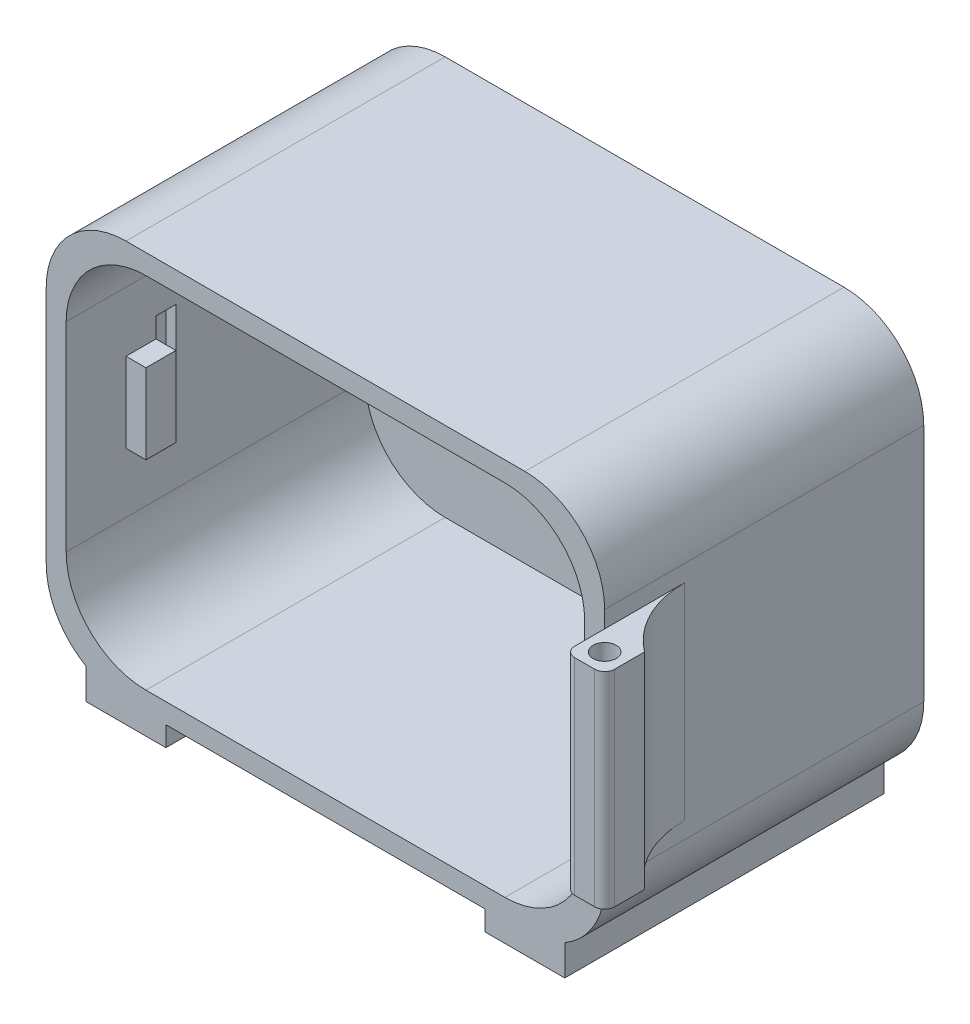
from build123d import *

# Parameters (mm, degrees)
BOSS_EXTRUDE1_DEPTH             = 95.25
BOSS_EXTRUDE2_DEPTH             = 6.35
SKETCH4_W                       = 25.4
SKETCH4_H                       = 101.6
BOSS_EXTRUDE3_DEPTH             = 6.35
BOSS_EXTRUDE3_DIRECTION_2_REACH = 187.35
BOSS_EXTRUDE5_DEPTH             = 32.766
BOSS_EXTRUDE5_DEPTH_BACK        = 32.766
SKETCH5_R                       = 3.675
FILLET1_R                       = 3.175
SKETCH8_W                       = 6.35
SKETCH8_H                       = 38.1
CUT_EXTRUDE1_DEPTH              = 3.175
SKETCH10_W                      = 9.525
SKETCH10_H                      = 25.4
BOSS_EXTRUDE6_DEPTH             = 6.35
SKETCH11_R                      = 44.824096384
CUT_EXTRUDE4_DEPTH              = 1.5875
SKETCH12_W                      = 1.13974359
SKETCH12_H                      = 13.025641026
SKETCH12_W_2                    = 4.884615385
SKETCH12_H_2                    = 1.302564103
CUT_EXTRUDE5_DEPTH              = 1.5875
FILLET2_R                       = 3.175


with BuildPart() as part:
    # Sketch1 → Boss-Extrude1 (new body)
    with BuildSketch(Plane.XY):
        with BuildLine():
            Line((-63.5, 63.5), (63.5, 63.5))
            ThreePointArc((63.5, 63.5), (81.460512242, 56.060512242), (88.9, 38.1))
            Line((88.9, 38.1), (88.9, -38.1))
            ThreePointArc((88.9, -38.1), (81.460512242, -56.060512242), (63.5, -63.5))
            Line((63.5, -63.5), (-63.5, -63.5))
            ThreePointArc((-63.5, -63.5), (-81.460512242, -56.060512242), (-88.9, -38.1))
            Line((-88.9, -38.1), (-88.9, 38.1))
            ThreePointArc((-88.9, 38.1), (-81.460512242, 56.060512242), (-63.5, 63.5))
        make_face()
        with BuildLine():
            Line((-82.55, 31.75), (-82.55, -31.75))
            ThreePointArc((-82.55, -31.75), (-75.110512242, -49.710512242), (-57.15, -57.15))
            Line((-57.15, -57.15), (57.15, -57.15))
            ThreePointArc((57.15, -57.15), (75.110512242, -49.710512242), (82.55, -31.75))
            Line((82.55, -31.75), (82.55, 31.75))
            ThreePointArc((82.55, 31.75), (75.110512242, 49.710512242), (57.15, 57.15))
            Line((57.15, 57.15), (-57.15, 57.15))
            ThreePointArc((-57.15, 57.15), (-75.110512242, 49.710512242), (-82.55, 31.75))
        make_face(mode=Mode.SUBTRACT)
    extrude(amount=-BOSS_EXTRUDE1_DEPTH)

    # Sketch2 → Boss-Extrude2 (add)
    with BuildSketch(Plane(origin=(0, 0, -95.25), x_dir=(-1, 0, 0), z_dir=(0, 0, -1))):
        with BuildLine():
            Line((-63.5, 63.5), (63.5, 63.5))
            ThreePointArc((63.5, 63.5), (81.460512242, 56.060512242), (88.9, 38.1))
            Line((88.9, 38.1), (88.9, -38.1))
            ThreePointArc((88.9, -38.1), (81.460512242, -56.060512242), (63.5, -63.5))
            Line((63.5, -63.5), (-63.5, -63.5))
            ThreePointArc((-63.5, -63.5), (-81.460512242, -56.060512242), (-88.9, -38.1))
            Line((-88.9, -38.1), (-88.9, 38.1))
            ThreePointArc((-88.9, 38.1), (-81.460512242, 56.060512242), (-63.5, 63.5))
        make_face()
    extrude(amount=BOSS_EXTRUDE2_DEPTH)

    # Sketch4 → Boss-Extrude3 (add)
    with BuildSketch(Plane.XZ.offset(63.5)):
        with Locations((-63.5, -50.8)):
            Rectangle(SKETCH4_W, SKETCH4_H)
        with Locations((63.5, -50.8)):
            Rectangle(SKETCH4_W, SKETCH4_H)
    extrude(amount=BOSS_EXTRUDE3_DEPTH)

    # Sketch4 → Boss-Extrude3 direction 2 (add, up to next)
    with BuildSketch(Plane.XZ.offset(63.5), mode=Mode.PRIVATE) as boss_extrude3_direction_2_sk1:
        with Locations((-63.5, -50.8)):
            Rectangle(SKETCH4_W, SKETCH4_H)
    boss_extrude3_direction_2_tool1 = extrude(boss_extrude3_direction_2_sk1.sketch, amount=-BOSS_EXTRUDE3_DIRECTION_2_REACH, mode=Mode.PRIVATE) - part.part
    # Sketch4 → Boss-Extrude3 direction 2 (add, up to next)
    with BuildSketch(Plane.XZ.offset(63.5), mode=Mode.PRIVATE) as boss_extrude3_direction_2_sk2:
        with Locations((63.5, -50.8)):
            Rectangle(SKETCH4_W, SKETCH4_H)
    boss_extrude3_direction_2_tool2 = extrude(boss_extrude3_direction_2_sk2.sketch, amount=-BOSS_EXTRUDE3_DIRECTION_2_REACH, mode=Mode.PRIVATE) - part.part
    add(boss_extrude3_direction_2_tool1.solids().sort_by_distance((-63.5, -63.5, -50.8))[0])
    add(boss_extrude3_direction_2_tool2.solids().sort_by_distance((63.5, -63.5, -50.8))[0])

    # Sketch5 → Boss-Extrude5 (add, two sides: drawn at the far end of the back side and taken through both)
    with BuildSketch(Plane(origin=(0, 0, 0), x_dir=(1, 0, 0), z_dir=(0, 1, 0)).offset(-BOSS_EXTRUDE5_DEPTH_BACK)):
        with BuildLine():
            ThreePointArc((101.6, 0), (92.251936686, 11.200968343), (88.9, 25.4))
            Line((88.9, 25.4), (88.9, 0))
            Line((88.9, 0), (88.9, -12.7))
            Line((88.9, -12.7), (101.6, -12.7))
            Line((101.6, -12.7), (101.6, 0))
        make_face()
        with Locations((95.25, -6.35)):
            Circle(SKETCH5_R, mode=Mode.SUBTRACT)
    extrude(amount=BOSS_EXTRUDE5_DEPTH + BOSS_EXTRUDE5_DEPTH_BACK)

    # Fillet1
    fillet1_edges = [part.edges().sort_by_distance(p)[0] for p in [
        (101.6, 0, 12.7),
    ]]
    fillet(fillet1_edges, radius=FILLET1_R)

    # Sketch8 → Cut-Extrude1 (cut)
    with BuildSketch(Plane(origin=(-82.55, 0, 0), x_dir=(0, 0, -1), z_dir=(1, 0, 0))):
        with Locations((31.75, 0)):
            Rectangle(SKETCH8_W, SKETCH8_H)
    extrude(amount=-CUT_EXTRUDE1_DEPTH, mode=Mode.SUBTRACT)

    # Sketch10 → Boss-Extrude6 (add)
    with BuildSketch(Plane(origin=(-82.55, 0, 0), x_dir=(0, 0, -1), z_dir=(1, 0, 0))):
        with Locations((23.8125, 0)):
            Rectangle(SKETCH10_W, SKETCH10_H)
    extrude(amount=BOSS_EXTRUDE6_DEPTH)

    # Sketch11 → Cut-Extrude4 (cut)
    # profile 1 of 2: a face of its own
    with BuildSketch(Plane(origin=(0, 0, -101.6), x_dir=(-1, 0, 0), z_dir=(0, 0, -1))):
        with Locations((0, 3.175)):
            Circle(SKETCH11_R)
        with BuildLine():
            Line((-8.558023622, 38.277554278), (9.414722671, 38.277554278))
            Line((9.414722671, 38.277554278), (12.376141094, 30.516595652))
            Line((12.376141094, 30.516595652), (6.555422124, 30.516595652))
            ThreePointArc((6.555422124, 30.516595652), (-1.070912861, 28.84594719), (6.555422124, 27.175298727))
            Line((6.555422124, 27.175298727), (13.309498487, 27.175298727))
            Line((13.309498487, 27.175298727), (31.249567059, -24.733260338))
            Line((31.249567059, -24.733260338), (24.338229167, -24.733260338))
            Line((24.338229167, -24.733260338), (24.338229167, -18.851270642))
            ThreePointArc((24.338229167, -18.851270642), (22.794206871, -11.23122082), (21.250184576, -18.851270642))
            Line((21.250184576, -18.851270642), (21.250184576, -24.733260338))
            Line((21.250184576, -24.733260338), (16.103443592, -24.733260338))
            Line((16.103443592, -24.733260338), (16.103443592, -18.851270642))
            ThreePointArc((16.103443592, -18.851270642), (14.239792343, -11.126064356), (12.376141094, -18.851270642))
            Line((12.376141094, -18.851270642), (12.376141094, -24.733260338))
            Line((12.376141094, -24.733260338), (10.515553381, -24.733260338))
            Line((10.515553381, -24.733260338), (8.456856988, -17.527822961))
            Line((8.456856988, -17.527822961), (-7.424515191, -17.527822961))
            Line((-7.424515191, -17.527822961), (-9.630261327, -24.733260338))
            Line((-9.630261327, -24.733260338), (-30.070175519, -24.733260338))
            Line((-30.070175519, -24.733260338), (-27.864429383, -17.527822961))
            Line((-27.864429383, -17.527822961), (-20.953091491, -17.527822961))
            ThreePointArc((-20.953091491, -17.527822961), (-12.798886715, -15.836750923), (-20.953091491, -14.145678885))
            Line((-20.953091491, -14.145678885), (-26.540981702, -14.145678885))
            Line((-26.540981702, -14.145678885), (-8.558023622, 38.277554278))
        make_face(mode=Mode.SUBTRACT)
    # profile 2 of 2: a face of its own
    with BuildSketch(Plane(origin=(0, 0, -101.6), x_dir=(-1, 0, 0), z_dir=(0, 0, -1))):
        Polygon((0.754840192, 15.029545848), (-4.852280703, -6.689071297), (6.018431459, -6.689071297), align=None)
    extrude(amount=-CUT_EXTRUDE4_DEPTH, mode=Mode.SUBTRACT)

    # Sketch12 → Cut-Extrude5 (cut)
    # profile 1 of 11: a face of its own
    with BuildSketch(Plane(origin=(0, 0, -101.6), x_dir=(-1, 0, 0), z_dir=(0, 0, -1))):
        with BuildLine():
            Line((51.288461538, -47.869230769), (52.428205128, -47.869230769))
            Line((52.428205128, -47.869230769), (52.428205128, -55.234314904))
            add(Edge.make_bspline(
                [(52.428205128, -55.234314904), (52.427199859, -55.391205604), (52.425259449, -55.694042448), (52.411285924, -56.131932206), (52.381819467, -56.536394859), (52.348405109, -56.909275054), (52.300338453, -57.248844425), (52.241641349, -57.556116225), (52.175471884, -57.831385323), (52.117341381, -58.000929746), (52.08984375, -58.081129808)],
                knots=[0, 0, 0, 0, 1.307562039, 2.523909702, 3.650326591, 4.686913197, 5.643429486, 6.506965704, 7.293745905, 8, 8, 8, 8], degree=3))
            add(Edge.make_bspline(
                [(52.08984375, -58.081129808), (52.049242798, -58.18537838), (51.969254836, -58.39075856), (51.819446966, -58.681894524), (51.651683945, -58.956019996), (51.460070878, -59.211607319), (51.245474246, -59.44737343), (51.012949975, -59.668440513), (50.757969566, -59.870131635), (50.48067881, -60.048966857), (50.187469798, -60.210028454), (49.878511085, -60.349534569), (49.555544866, -60.471043973), (49.215537231, -60.562058689), (48.863818951, -60.640924675), (48.496253987, -60.692249677), (48.114989839, -60.727182146), (47.855745174, -60.730412419), (47.72421875, -60.732051282)],
                knots=[0, 0, 0, 0, 0.981931301, 1.934503488, 2.87077864, 3.801706999, 4.735015492, 5.667491629, 6.616593066, 7.585388521, 8.561939025, 9.551802639, 10.560317337, 11.588439944, 12.640189604, 13.723962949, 14.845264515, 16, 16, 16, 16], degree=3))
            add(Edge.make_bspline(
                [(47.72421875, -60.732051282), (47.532322713, -60.728943462), (47.157498196, -60.722873055), (46.611017223, -60.652148877), (46.092005525, -60.552165866), (45.607321067, -60.400834743), (45.160026716, -60.21564338), (44.753177225, -60.003027408), (44.39042492, -59.759226202), (44.063404735, -59.481638307), (43.768250965, -59.151570091), (43.490566228, -58.762591428), (43.223282238, -58.308777287), (43.066641753, -57.975700871), (42.984615385, -57.801282051)],
                knots=[0, 0, 0, 0, 1.157897085, 2.2616841, 3.32207898, 4.345638746, 5.321241055, 6.241986252, 7.112515963, 7.955008012, 8.825025602, 9.77857164, 10.836726669, 12, 12, 12, 12], degree=3))
            Line((42.984615385, -57.801282051), (44.124358974, -57.801282051))
            add(Edge.make_bspline(
                [(44.124358974, -57.801282051), (44.216024705, -57.946809086), (44.395219921, -58.231296519), (44.730312981, -58.599644257), (45.097547365, -58.914435037), (45.509316501, -59.168111274), (45.967333711, -59.359372517), (46.471874544, -59.495717165), (47.0270446, -59.577346476), (47.413553549, -59.5871846), (47.614823718, -59.592307692)],
                knots=[0, 0, 0, 0, 0.997731894, 1.950442991, 2.880492273, 3.800895997, 4.748200782, 5.754801363, 6.83083817, 8, 8, 8, 8], degree=3))
            add(Edge.make_bspline(
                [(47.614823718, -59.592307692), (47.813549291, -59.587118295), (48.196672306, -59.577113657), (48.747602548, -59.495680734), (49.25050418, -59.359342846), (49.702479765, -59.168449559), (50.098196411, -58.934586655), (50.439325637, -58.673329242), (50.715622033, -58.378758174), (50.90145194, -58.107407049), (51.016966124, -57.865656635), (51.090525383, -57.657548644), (51.150302358, -57.422225345), (51.200303483, -57.160475674), (51.241563654, -56.871925661), (51.267699828, -56.55591554), (51.286589487, -56.213163505), (51.287823092, -55.975516975), (51.288461538, -55.852524038)],
                knots=[0, 0, 0, 0, 1.570740765, 3.028230971, 4.391408896, 5.680370741, 6.894727393, 8.017376726, 9.065722033, 10.075533815, 10.603371122, 11.180248986, 11.817768598, 12.521299649, 13.286540596, 14.121245857, 15.027658897, 16, 16, 16, 16], degree=3))
            Line((51.288461538, -55.852524038), (51.288461538, -55.371694712))
            add(Edge.make_bspline(
                [(51.288461538, -55.371694712), (51.172778627, -55.509369251), (50.94344763, -55.782296676), (50.547398758, -56.139934615), (50.114811664, -56.447950002), (49.64642281, -56.70056619), (49.153705474, -56.902610217), (48.641996238, -57.043917532), (48.115882209, -57.135212026), (47.759367265, -57.145035716), (47.579206731, -57.15)],
                knots=[0, 0, 0, 0, 1.012485704, 2.007162095, 2.997754123, 3.998611389, 4.999708251, 5.992315798, 6.98544096, 8, 8, 8, 8], degree=3))
            add(Edge.make_bspline(
                [(47.579206731, -57.15), (47.473120839, -57.14813119), (47.262204473, -57.144415684), (46.948860104, -57.111908121), (46.640139657, -57.064741256), (46.336763132, -56.995502891), (46.038292765, -56.906632912), (45.745221788, -56.795537889), (45.455177277, -56.66993446), (45.173431413, -56.52198743), (44.90279031, -56.357387059), (44.645295324, -56.179083085), (44.402295197, -55.988008724), (44.176102792, -55.782279829), (43.967014813, -55.562194153), (43.772219063, -55.330097832), (43.594936689, -55.082749942), (43.43152982, -54.824660696), (43.289806709, -54.554111058), (43.165403416, -54.276967683), (43.057237861, -53.993823162), (42.971003403, -53.703729535), (42.905140792, -53.406869688), (42.856117969, -53.103729945), (42.828312474, -52.793376824), (42.823976607, -52.584293643), (42.821794872, -52.479086538)],
                knots=[0, 0, 0, 0, 1.028754217, 2.045334182, 3.052854819, 4.056607503, 5.061168794, 6.071104265, 7.095078842, 8.125279047, 9.155117945, 10.165957491, 11.161587969, 12.151493252, 13.128948131, 14.104219989, 15.088194871, 16.07871515, 17.064853787, 18.047899887, 19.02414258, 20.002704429, 20.980574569, 21.971845993, 22.979467364, 24, 24, 24, 24], degree=3))
            add(Edge.make_bspline(
                [(42.821794872, -52.479086538), (42.823678704, -52.373846733), (42.827439071, -52.163774731), (42.859918339, -51.852155247), (42.906248626, -51.544708439), (42.97957396, -51.244603296), (43.06782997, -50.948422054), (43.177135505, -50.658352398), (43.30855786, -50.374305979), (43.457364666, -50.096072451), (43.624584088, -49.827385391), (43.807944804, -49.572200133), (44.007668176, -49.332394481), (44.220998841, -49.105549178), (44.450541606, -48.893852903), (44.696177721, -48.697819459), (44.955485887, -48.514162849), (45.229269765, -48.346844569), (45.513304861, -48.198863274), (45.800375, -48.063834708), (46.094282881, -47.956668046), (46.389548953, -47.862241372), (46.691373215, -47.79534795), (46.9960549, -47.743741529), (47.304637097, -47.71230097), (47.511294745, -47.708376362), (47.614823718, -47.706410256)],
                knots=[0, 0, 0, 0, 1.008818848, 2.013730394, 3.001654427, 3.987803273, 4.973046549, 5.963777569, 6.957074694, 7.972068341, 8.987420212, 9.989399531, 10.982630087, 11.977756091, 12.973280677, 13.973972381, 14.989194003, 16.018387222, 17.047741039, 18.059210846, 19.057554164, 20.045176975, 21.029480261, 22.018708529, 23.007435371, 24, 24, 24, 24], degree=3))
            add(Edge.make_bspline(
                [(47.614823718, -47.706410256), (47.785551411, -47.711333042), (48.122686145, -47.721054032), (48.618824354, -47.797330759), (49.097586196, -47.918938751), (49.561673282, -48.093166896), (50.014866073, -48.331019892), (50.455670936, -48.644321446), (50.885363223, -49.035881822), (51.150531351, -49.336156501), (51.288461538, -49.492347756)],
                knots=[0, 0, 0, 0, 0.96728863, 1.910097829, 2.838038873, 3.762875196, 4.71315279, 5.730631239, 6.819562287, 8, 8, 8, 8], degree=3))
            Line((51.288461538, -49.492347756), (51.288461538, -47.869230769))
        make_face()
        with BuildLine():
            add(Edge.make_bspline(
                [(47.706410256, -48.846153846), (47.539747417, -48.851818284), (47.209790334, -48.863032669), (46.726144062, -48.958771486), (46.259230618, -49.108798037), (45.817976636, -49.323401242), (45.404656551, -49.585000334), (45.037899346, -49.901920806), (44.717115793, -50.263857006), (44.44576056, -50.667536474), (44.229746744, -51.103045873), (44.076826336, -51.562099108), (43.97794768, -52.037278654), (43.9670342, -52.361573528), (43.961538462, -52.524879808)],
                knots=[0, 0, 0, 0, 1.026226791, 2.031711442, 3.026614839, 4.04107745, 5.047145931, 6.032893242, 7.017642609, 8.019221815, 9.021877557, 10.003543541, 10.994637589, 12, 12, 12, 12], degree=3))
            add(Edge.make_bspline(
                [(43.961538462, -52.524879808), (43.964171922, -52.648009111), (43.969351169, -52.890168444), (44.019148151, -53.24554309), (44.099633367, -53.584017371), (44.213705516, -53.905611758), (44.355048152, -54.212170871), (44.532820469, -54.501582952), (44.742011138, -54.774105742), (44.980982821, -55.027723588), (45.244331407, -55.258721959), (45.529969644, -55.461697135), (45.837510122, -55.627706894), (46.159389119, -55.771183647), (46.503416719, -55.875973408), (46.864637689, -55.955942692), (47.245607559, -56.001694469), (47.505310727, -56.007365193), (47.637720353, -56.01025641)],
                knots=[0, 0, 0, 0, 1.039728707, 2.044842319, 3.024901384, 3.974314358, 4.923051295, 5.871625912, 6.837440708, 7.820715446, 8.810779094, 9.792721783, 10.773906224, 11.758876063, 12.764959493, 13.806266761, 14.881525401, 16, 16, 16, 16], degree=3))
            add(Edge.make_bspline(
                [(47.637720353, -56.01025641), (47.771845989, -56.007471086), (48.034127251, -56.002024414), (48.417198935, -55.955203148), (48.780174878, -55.87964912), (49.122722262, -55.772377571), (49.446134443, -55.635501504), (49.74677833, -55.462285778), (50.031100299, -55.265020553), (50.290022128, -55.03492553), (50.524152671, -54.781342834), (50.728190025, -54.5054085), (50.902051026, -54.211274617), (51.046024285, -53.898974339), (51.155938083, -53.566080658), (51.229666681, -53.213425767), (51.281216871, -52.8426992), (51.286009941, -52.588667936), (51.288461538, -52.458733974)],
                knots=[0, 0, 0, 0, 1.121943988, 2.193949579, 3.223793937, 4.220241907, 5.192961521, 6.155822191, 7.11847367, 8.083710714, 9.04790392, 10.001595906, 10.949595423, 11.902125208, 12.873731292, 13.87582262, 14.913508608, 16, 16, 16, 16], degree=3))
            add(Edge.make_bspline(
                [(51.288461538, -52.458733974), (51.28360082, -52.289577761), (51.274104683, -51.959105963), (51.184489283, -51.477569977), (51.039998806, -51.024837932), (50.837354876, -50.602341676), (50.583420159, -50.214557882), (50.277564793, -49.868668503), (49.925063482, -49.564228252), (49.526929004, -49.310597664), (49.098585417, -49.105708802), (48.650379935, -48.951996086), (48.182977974, -48.864931), (47.866180431, -48.85244892), (47.706410256, -48.846153846)],
                knots=[0, 0, 0, 0, 1.070913519, 2.092188694, 3.091357305, 4.074328408, 5.051968682, 6.018948707, 6.99050112, 7.9935919, 9.000589572, 9.992915277, 10.987769056, 12, 12, 12, 12], degree=3))
        make_face(mode=Mode.SUBTRACT)
    # profile 2 of 11: a face of its own
    with BuildSketch(Plane(origin=(0, 0, -101.6), x_dir=(-1, 0, 0), z_dir=(0, 0, -1))):
        with BuildLine():
            Line((37.611538462, -47.869230769), (38.751282051, -47.869230769))
            Line((38.751282051, -47.869230769), (38.751282051, -49.235396635))
            add(Edge.make_bspline(
                [(38.751282051, -49.235396635), (38.835424119, -49.108194058), (38.996345169, -48.864920117), (39.263817798, -48.543177225), (39.537787029, -48.276785485), (39.819564423, -48.064501288), (40.1112221, -47.905522257), (40.406359039, -47.789070387), (40.709618601, -47.720209843), (40.913406155, -47.71101628), (41.015504808, -47.706410256)],
                knots=[0, 0, 0, 0, 1.2804753, 2.448899062, 3.506932113, 4.484331642, 5.4025378, 6.288909075, 7.142734305, 8, 8, 8, 8], degree=3))
            add(Edge.make_bspline(
                [(41.015504808, -47.706410256), (41.094703192, -47.710730167), (41.257659016, -47.719618664), (41.504338699, -47.782069371), (41.758496367, -47.881775338), (41.922298744, -47.975538432), (42.007692308, -48.024419071)],
                knots=[0, 0, 0, 0, 0.901110191, 1.854092781, 2.881294221, 4, 4, 4, 4], degree=3))
            Line((42.007692308, -48.024419071), (41.381850962, -49.011518429))
            add(Edge.make_bspline(
                [(41.381850962, -49.011518429), (41.327026799, -48.987060892), (41.222960044, -48.940635805), (41.070724903, -48.88569194), (40.93036691, -48.853339902), (40.840945998, -48.848438728), (40.799258814, -48.846153846)],
                knots=[0, 0, 0, 0, 1.180555205, 2.24091978, 3.179933427, 4, 4, 4, 4], degree=3))
            add(Edge.make_bspline(
                [(40.799258814, -48.846153846), (40.70779801, -48.852249982), (40.52124448, -48.864684331), (40.247343582, -48.962433719), (39.981560865, -49.120368162), (39.770480833, -49.295523339), (39.607041802, -49.464425347), (39.490418698, -49.61192098), (39.383438444, -49.7773063), (39.281220787, -49.957754009), (39.188088806, -50.156345165), (39.101167577, -50.371095682), (39.022576846, -50.602254292), (38.977763103, -50.763299437), (38.954807692, -50.845793269)],
                knots=[0, 0, 0, 0, 1.125678352, 2.296057538, 3.5422874, 4.923748041, 5.663163013, 6.437101912, 7.23742474, 8.08941207, 8.991984279, 9.93940061, 10.944477711, 12, 12, 12, 12], degree=3))
            add(Edge.make_bspline(
                [(38.954807692, -50.845793269), (38.937635865, -50.919370442), (38.899601572, -51.082338288), (38.862620849, -51.355745792), (38.826082884, -51.678774497), (38.800332297, -52.052323563), (38.776463402, -52.475460145), (38.763001103, -52.948828862), (38.751741136, -53.472915593), (38.751439722, -53.839308246), (38.751282051, -54.030969551)],
                knots=[0, 0, 0, 0, 0.566838948, 1.255505196, 2.06880316, 3.007127437, 4.065329342, 5.249902469, 6.561414163, 8, 8, 8, 8], degree=3))
            Line((38.751282051, -54.030969551), (38.751282051, -57.15))
            Line((38.751282051, -57.15), (37.611538462, -57.15))
            Line((37.611538462, -57.15), (37.611538462, -47.869230769))
        make_face()
    # profile 3 of 11: a face of its own
    with BuildSketch(Plane(origin=(0, 0, -101.6), x_dir=(-1, 0, 0), z_dir=(0, 0, -1))):
        with BuildLine():
            add(Edge.make_bspline(
                [(30.859575321, -47.706410256), (31.033715082, -47.710118261), (31.375160597, -47.717388753), (31.875206354, -47.795094486), (32.352527276, -47.913920636), (32.808951459, -48.078191733), (33.238633445, -48.298380525), (33.647831959, -48.56112281), (34.035425106, -48.872391078), (34.267737241, -49.113176069), (34.385657051, -49.235396635)],
                knots=[0, 0, 0, 0, 1.054011418, 2.066658804, 3.057071809, 4.030435133, 4.997543892, 5.974964718, 6.972108034, 8, 8, 8, 8], degree=3))
            add(Edge.make_bspline(
                [(34.385657051, -49.235396635), (34.48719157, -49.352287383), (34.688295636, -49.583806722), (34.946162673, -49.959202803), (35.168309477, -50.347968311), (35.346337935, -50.755265754), (35.486709307, -51.17753956), (35.586370547, -51.616241144), (35.645650283, -52.070401661), (35.653643906, -52.378844159), (35.657692308, -52.53505609)],
                knots=[0, 0, 0, 0, 1.025258237, 2.030674902, 3.01204498, 3.988269485, 4.97094183, 5.956517959, 6.965070386, 8, 8, 8, 8], degree=3))
            add(Edge.make_bspline(
                [(35.657692308, -52.53505609), (35.654131455, -52.692173442), (35.647095044, -53.002644657), (35.580533922, -53.459914927), (35.477006839, -53.90330757), (35.328845598, -54.330966258), (35.138860458, -54.744198232), (34.907028535, -55.141198597), (34.631722953, -55.522750623), (34.319651307, -55.885614436), (33.974748785, -56.22004613), (33.600584476, -56.511522994), (33.204511268, -56.761246811), (32.781262529, -56.962401804), (32.334703362, -57.121005574), (31.863870572, -57.232402777), (31.369495603, -57.299755172), (31.031939685, -57.308404138), (30.859575321, -57.312820513)],
                knots=[0, 0, 0, 0, 0.998656419, 1.973391657, 2.932242238, 3.890759089, 4.846373663, 5.82037756, 6.809684879, 7.83454468, 8.860553229, 9.859544525, 10.845671541, 11.83227036, 12.833544569, 13.85385346, 14.904124723, 16, 16, 16, 16], degree=3))
            add(Edge.make_bspline(
                [(30.859575321, -57.312820513), (30.686366481, -57.308389315), (30.347128219, -57.299710591), (29.851008227, -57.23266445), (29.37933161, -57.121056914), (28.932187838, -56.961880583), (28.507119393, -56.761240381), (28.108751247, -56.512277965), (27.734282983, -56.219959687), (27.389307496, -55.885637858), (27.077255414, -55.522744588), (26.801944784, -55.141200163), (26.570114172, -54.744197824), (26.380128689, -54.330966367), (26.231967539, -53.90330754), (26.128440432, -53.459914935), (26.061879316, -53.002644655), (26.054842904, -52.692173441), (26.051282051, -52.53505609)],
                knots=[0, 0, 0, 0, 1.099876186, 2.154163076, 3.173186993, 4.173200201, 5.163417411, 6.152872554, 7.150605724, 8.17532212, 9.198891216, 10.186952605, 11.159729845, 12.11414092, 13.071450619, 14.029093627, 15.002601286, 16, 16, 16, 16], degree=3))
            add(Edge.make_bspline(
                [(26.051282051, -52.53505609), (26.055358063, -52.379693195), (26.063427866, -52.072101363), (26.122647999, -51.6187946), (26.221920475, -51.180835503), (26.362460114, -50.760191633), (26.542129521, -50.35467905), (26.761154766, -49.964952949), (27.021652204, -49.591254359), (27.221956428, -49.36003424), (27.323317308, -49.243028846)],
                knots=[0, 0, 0, 0, 1.031353054, 2.041901799, 3.029428768, 4.008703097, 4.981709435, 5.96992636, 6.972712378, 8, 8, 8, 8], degree=3))
            add(Edge.make_bspline(
                [(27.323317308, -49.243028846), (27.441059338, -49.119748352), (27.672619758, -48.877295569), (28.062142285, -48.566934696), (28.47033415, -48.298724942), (28.904764596, -48.082911246), (29.360813823, -47.912954339), (29.840580789, -47.794788041), (30.342323374, -47.717668724), (30.685439713, -47.710200479), (30.859575321, -47.706410256)],
                knots=[0, 0, 0, 0, 1.027980169, 2.021703884, 2.998553061, 3.971491411, 4.943284454, 5.930300938, 6.949603206, 8, 8, 8, 8], degree=3))
        make_face()
        with BuildLine():
            add(Edge.make_bspline(
                [(30.854487179, -48.846153846), (30.731342133, -48.849653936), (30.488231009, -48.856563761), (30.130382801, -48.909119644), (29.785885671, -48.992386302), (29.454086037, -49.110692449), (29.136102811, -49.26345131), (28.831631551, -49.451078789), (28.539776698, -49.671089802), (28.266247496, -49.923140068), (28.015214535, -50.19847242), (27.795765877, -50.491836465), (27.609166206, -50.798473778), (27.453717629, -51.11870323), (27.337940118, -51.455769989), (27.25385515, -51.805856851), (27.201348849, -52.169677077), (27.19450399, -52.4170042), (27.191025641, -52.542688301)],
                knots=[0, 0, 0, 0, 1.021534396, 2.016698045, 2.994645724, 3.958388632, 4.93408049, 5.916473867, 6.921342795, 7.962252576, 8.998418191, 10.008913653, 10.997312074, 11.973003931, 12.956656626, 13.948281152, 14.957379055, 16, 16, 16, 16], degree=3))
            add(Edge.make_bspline(
                [(27.191025641, -52.542688301), (27.196856115, -52.705074228), (27.208428517, -53.027379928), (27.302536375, -53.502037431), (27.45996659, -53.957720151), (27.672554719, -54.391756752), (27.938914427, -54.793339018), (28.252738926, -55.151375547), (28.610660125, -55.460478348), (29.008411425, -55.716948845), (29.437868522, -55.92072853), (29.89237003, -56.065141956), (30.36640912, -56.15901924), (30.69037063, -56.168350018), (30.854487179, -56.173076923)],
                knots=[0, 0, 0, 0, 1.016792936, 2.018143844, 3.017858371, 4.030088057, 5.03801393, 6.028138512, 7.003788237, 7.991172063, 8.984598303, 9.972568034, 10.972917682, 12, 12, 12, 12], degree=3))
            add(Edge.make_bspline(
                [(30.854487179, -56.173076923), (31.01859429, -56.168322478), (31.342537166, -56.158937334), (31.815917608, -56.06561476), (32.269176877, -55.920095762), (32.698187912, -55.717178029), (33.095758159, -55.45950441), (33.456253542, -55.153120985), (33.767398502, -54.792390724), (34.033494726, -54.391224834), (34.249564335, -53.958393042), (34.406257667, -53.501953328), (34.500591765, -53.027401347), (34.512133629, -52.705081404), (34.517948718, -52.542688301)],
                knots=[0, 0, 0, 0, 1.02726834, 2.027799167, 3.010890988, 4.004497153, 4.992059811, 5.971914811, 6.958719428, 7.966827853, 8.981595046, 9.981490638, 10.983022906, 12, 12, 12, 12], degree=3))
            add(Edge.make_bspline(
                [(34.517948718, -52.542688301), (34.514471567, -52.417003449), (34.507629064, -52.169674847), (34.455105622, -51.805865373), (34.371084092, -51.455738722), (34.255072795, -51.118818596), (34.100299659, -50.797644652), (33.910101582, -50.492736785), (33.691549004, -50.197456175), (33.437486879, -49.924030107), (33.164243194, -49.670991546), (32.872270055, -49.450993476), (32.568250276, -49.264275915), (32.251190847, -49.109385842), (31.919348673, -48.993462636), (31.575334233, -48.908638858), (31.219012837, -48.856785859), (30.97677288, -48.849720517), (30.854487179, -48.846153846)],
                knots=[0, 0, 0, 0, 1.042956736, 2.052379634, 3.044323526, 4.02829302, 5.004299113, 5.996692471, 7.007513377, 8.048758398, 9.090003419, 10.095195979, 11.07790575, 12.047570684, 13.018257071, 13.989683339, 14.985167495, 16, 16, 16, 16], degree=3))
        make_face(mode=Mode.SUBTRACT)
    # profile 4 of 11: a face of its own
    with BuildSketch(Plane(origin=(0, 0, -101.6), x_dir=(-1, 0, 0), z_dir=(0, 0, -1))):
        with BuildLine():
            add(Edge.make_bspline(
                [(22.876282051, -55.196153846), (22.947003678, -55.200356337), (23.08564516, -55.208594828), (23.286084283, -55.265115901), (23.467493477, -55.365477327), (23.629081908, -55.499236551), (23.76227398, -55.661417957), (23.866212057, -55.841380255), (23.922240775, -56.043497462), (23.930419255, -56.182942283), (23.934615385, -56.254487179)],
                knots=[0, 0, 0, 0, 1.020151414, 1.999887582, 2.974338812, 3.990962822, 5.007586832, 5.987933904, 6.967670073, 8, 8, 8, 8], degree=3))
            add(Edge.make_bspline(
                [(23.934615385, -56.254487179), (23.930277062, -56.324312976), (23.921721953, -56.462008421), (23.866340489, -56.662601157), (23.76148185, -56.842675925), (23.63000059, -57.007057969), (23.467453531, -57.141100557), (23.285655403, -57.240608122), (23.086115694, -57.301176163), (22.947082178, -57.308891584), (22.876282051, -57.312820513)],
                knots=[0, 0, 0, 0, 1.009421747, 1.99056486, 2.972319754, 3.999869655, 5.017953583, 5.993804169, 6.978383603, 8, 8, 8, 8], degree=3))
            add(Edge.make_bspline(
                [(22.876282051, -57.312820513), (22.805430908, -57.309033746), (22.667110917, -57.301640985), (22.468316023, -57.239364517), (22.285410737, -57.142033675), (22.122895326, -57.006808032), (21.990312872, -56.843521797), (21.890072197, -56.661360993), (21.829873657, -56.462582635), (21.821956576, -56.324426073), (21.817948718, -56.254487179)],
                knots=[0, 0, 0, 0, 1.022052826, 1.995314843, 2.982371812, 4.00089066, 5.028879526, 6.005146991, 6.990147033, 8, 8, 8, 8], degree=3))
            add(Edge.make_bspline(
                [(21.817948718, -56.254487179), (21.821802621, -56.182825145), (21.829326894, -56.042913817), (21.890198575, -55.842619912), (21.989535115, -55.660580147), (22.123811834, -55.499483985), (22.285371422, -55.364547201), (22.467874795, -55.266340666), (22.667589699, -55.208136885), (22.805511475, -55.200217467), (22.876282051, -55.196153846)],
                knots=[0, 0, 0, 0, 1.032775665, 2.016367738, 2.991239715, 4.008302682, 5.025365648, 6.011011707, 6.979408107, 8, 8, 8, 8], degree=3))
        make_face()
    # profile 5 of 11: a face of its own
    with BuildSketch(Plane(origin=(0, 0, -101.6), x_dir=(-1, 0, 0), z_dir=(0, 0, -1))):
        with BuildLine():
            Line((9.606410256, -57.15), (9.606410256, -44.124358974))
            Line((9.606410256, -44.124358974), (10.746153846, -44.124358974))
            Line((10.746153846, -44.124358974), (10.746153846, -49.553405449))
            add(Edge.make_bspline(
                [(10.746153846, -49.553405449), (10.874581395, -49.405512382), (11.125148837, -49.116966911), (11.54525196, -48.740148296), (11.985780741, -48.420643593), (12.450086412, -48.157259677), (12.938829341, -47.956695446), (13.44948585, -47.810019917), (13.98336134, -47.721530297), (14.347376629, -47.711493403), (14.531730769, -47.706410256)],
                knots=[0, 0, 0, 0, 1.077089805, 2.101446609, 3.097517232, 4.067117542, 5.031729543, 5.997785507, 6.985986182, 8, 8, 8, 8], degree=3))
            add(Edge.make_bspline(
                [(14.531730769, -47.706410256), (14.695619326, -47.710910513), (15.019654935, -47.719808287), (15.496021583, -47.787424885), (15.954358324, -47.897072337), (16.394415675, -48.049081102), (16.81414027, -48.250767906), (17.217125991, -48.492217794), (17.601308192, -48.779739731), (17.96073592, -49.108482173), (18.292002307, -49.465376204), (18.581970558, -49.847030491), (18.826898027, -50.247897247), (19.02948586, -50.666634617), (19.186135109, -51.104952805), (19.29405705, -51.56242204), (19.362613335, -52.038592279), (19.371250228, -52.362670166), (19.375641026, -52.527423878)],
                knots=[0, 0, 0, 0, 1.034377878, 2.045141349, 3.03070803, 4.00595497, 4.978199603, 5.965204761, 6.967410914, 8.002051993, 9.036360596, 10.037508045, 11.022711142, 11.997267194, 12.969246472, 13.954813154, 14.960274251, 16, 16, 16, 16], degree=3))
            add(Edge.make_bspline(
                [(19.375641026, -52.527423878), (19.371154513, -52.689621085), (19.362307816, -53.009448434), (19.29473907, -53.480097938), (19.183174052, -53.933084075), (19.023657758, -54.367236323), (18.823124981, -54.784594294), (18.572349781, -55.180400332), (18.282749868, -55.561541758), (17.947719701, -55.915776078), (17.585176237, -56.243194415), (17.19723027, -56.527695697), (16.793653583, -56.773412104), (16.368156005, -56.968104728), (15.927037683, -57.125588072), (15.465572708, -57.234872264), (14.986371852, -57.298637349), (14.660820457, -57.30805555), (14.496113782, -57.312820513)],
                knots=[0, 0, 0, 0, 1.024244038, 2.01964794, 2.996620209, 3.965911562, 4.936179293, 5.91563013, 6.920572822, 7.955171681, 8.990768464, 10.002129126, 10.989675881, 11.969873457, 12.952483066, 13.943799762, 14.959703725, 16, 16, 16, 16], degree=3))
            add(Edge.make_bspline(
                [(14.496113782, -57.312820513), (14.30755466, -57.307593163), (13.9378231, -57.297343241), (13.396974858, -57.212365802), (12.885050378, -57.067725103), (12.396218131, -56.873372446), (11.937466108, -56.610197044), (11.505881709, -56.28378255), (11.104186614, -55.888750369), (10.867542741, -55.58735582), (10.746153846, -55.432752404)],
                knots=[0, 0, 0, 0, 1.035807596, 2.031038093, 2.998900396, 3.954262848, 4.914341711, 5.895762244, 6.92060972, 8, 8, 8, 8], degree=3))
            Line((10.746153846, -55.432752404), (10.746153846, -57.15))
            Line((10.746153846, -57.15), (9.606410256, -57.15))
        make_face()
        with BuildLine():
            add(Edge.make_bspline(
                [(14.4859375, -56.173076923), (14.652541008, -56.167149184), (14.981389832, -56.15544877), (15.464148729, -56.06410448), (15.926117432, -55.912124982), (16.364968045, -55.704266954), (16.773832977, -55.442929856), (17.139058249, -55.126713752), (17.463741766, -54.765665399), (17.734621068, -54.358417426), (17.960776298, -53.924981052), (18.116127329, -53.469035444), (18.220338889, -53.002782924), (18.230688657, -52.686567277), (18.235897436, -52.527423878)],
                knots=[0, 0, 0, 0, 1.031910345, 2.036826888, 3.032245421, 4.038315463, 5.03827337, 6.029480047, 7.023177075, 8.037597977, 9.052889626, 10.043399556, 11.015292101, 12, 12, 12, 12], degree=3))
            add(Edge.make_bspline(
                [(18.235897436, -52.527423878), (18.229047622, -52.368436055), (18.215375342, -52.051095128), (18.119672559, -51.58065205), (17.952548578, -51.124948383), (17.730777466, -50.685245396), (17.455485062, -50.275188521), (17.132520565, -49.906924345), (16.762835155, -49.589206688), (16.353447319, -49.324357001), (15.917364913, -49.108240909), (15.458384613, -48.960031816), (14.986096568, -48.863010394), (14.665347208, -48.851801271), (14.503745994, -48.846153846)],
                knots=[0, 0, 0, 0, 0.984795267, 1.965658976, 2.959410029, 3.983795688, 5.009594896, 6.01088574, 7.009236619, 8.019050059, 9.024672985, 10.014834719, 10.999826153, 12, 12, 12, 12], degree=3))
            add(Edge.make_bspline(
                [(14.503745994, -48.846153846), (14.338763895, -48.85179808), (14.011307906, -48.863000738), (13.5280975, -48.960202271), (13.056153584, -49.109146461), (12.605167397, -49.322983071), (12.184782682, -49.584644657), (11.808816917, -49.892130523), (11.48467098, -50.243303333), (11.217812154, -50.637024385), (11.00588617, -51.062238657), (10.854270855, -51.515854366), (10.763557852, -51.9954837), (10.752025771, -52.32435276), (10.746153846, -52.491806891)],
                knots=[0, 0, 0, 0, 1.016820015, 2.018181405, 3.029022337, 4.06341356, 5.088169224, 6.076823655, 7.05054209, 8.02560866, 9.001194327, 9.972267242, 10.967515442, 12, 12, 12, 12], degree=3))
            add(Edge.make_bspline(
                [(10.746153846, -52.491806891), (10.749636079, -52.620032689), (10.756490215, -52.872421638), (10.808851838, -53.242999258), (10.892148096, -53.597630765), (11.009508775, -53.936702605), (11.16372754, -54.258289972), (11.349547648, -54.564890034), (11.57071505, -54.853736216), (11.820747532, -55.124120378), (12.096382456, -55.370171681), (12.392194915, -55.58345267), (12.702139979, -55.767109874), (13.029763587, -55.913504017), (13.371253127, -56.032980249), (13.730112822, -56.111842697), (14.102663419, -56.166180696), (14.356834314, -56.170753977), (14.4859375, -56.173076923)],
                knots=[0, 0, 0, 0, 1.050331198, 2.067384183, 3.060053655, 4.031335885, 5.001026174, 5.976994447, 6.963687968, 7.976578778, 8.990422448, 9.985569286, 10.960374351, 11.936812464, 12.921228065, 13.919088064, 14.943024695, 16, 16, 16, 16], degree=3))
        make_face(mode=Mode.SUBTRACT)
    # profile 6 of 11: a face of its own
    with BuildSketch(Plane(origin=(0, 0, -101.6), x_dir=(-1, 0, 0), z_dir=(0, 0, -1))):
        with BuildLine():
            Line((7.001282051, -47.869230769), (7.001282051, -57.15))
            Line((7.001282051, -57.15), (5.861538462, -57.15))
            Line((5.861538462, -57.15), (5.861538462, -55.544691506))
            add(Edge.make_bspline(
                [(5.861538462, -55.544691506), (5.73301885, -55.689978033), (5.482211212, -55.973506517), (5.063324869, -56.343918971), (4.619303195, -56.650091738), (4.152301258, -56.897378575), (3.662740775, -57.083132608), (3.151706973, -57.215162385), (2.618991391, -57.300048587), (2.255218561, -57.308525009), (2.070873397, -57.312820513)],
                knots=[0, 0, 0, 0, 1.074387032, 2.096679803, 3.090159297, 4.057316773, 5.018401886, 5.985159533, 6.978961417, 8, 8, 8, 8], degree=3))
            add(Edge.make_bspline(
                [(2.070873397, -57.312820513), (1.906978251, -57.308370533), (1.583769764, -57.299594977), (1.108321399, -57.231514618), (0.650786665, -57.122183505), (0.210733216, -56.970143135), (-0.208991426, -56.768464154), (-0.61198092, -56.527014482), (-0.996147545, -56.23948347), (-1.355635701, -55.910778339), (-1.686677531, -55.553745099), (-1.977185577, -55.172942687), (-2.219403896, -54.770017755), (-2.421951046, -54.35007174), (-2.577966353, -53.909871889), (-2.686727825, -53.450940451), (-2.754728875, -52.973820053), (-2.763500804, -52.648919497), (-2.767948718, -52.484174679)],
                knots=[0, 0, 0, 0, 1.033919861, 2.038935746, 3.024066025, 3.998881131, 4.97069526, 5.957263378, 6.95902576, 7.993208707, 9.027059324, 10.027763471, 11.009749337, 11.988697705, 12.965288445, 13.950418724, 14.960734635, 16, 16, 16, 16], degree=3))
            add(Edge.make_bspline(
                [(-2.767948718, -52.484174679), (-2.763402222, -52.322834955), (-2.754414044, -52.003875024), (-2.687455218, -51.534778034), (-2.574856986, -51.082954631), (-2.416840511, -50.649859437), (-2.214213988, -50.234968397), (-1.967732073, -49.837988078), (-1.677376963, -49.457824836), (-1.342632515, -49.103417813), (-0.980012063, -48.77604587), (-0.592086096, -48.491533048), (-0.188504476, -48.245817625), (0.236992734, -48.051132154), (0.678107657, -47.893619117), (1.138767303, -47.784642347), (1.617055032, -47.720426353), (1.941777674, -47.71112718), (2.106490385, -47.706410256)],
                knots=[0, 0, 0, 0, 1.020392517, 2.01726096, 2.990465484, 3.961182959, 4.928053699, 5.906110375, 6.912531644, 7.948652711, 8.985773172, 9.998621852, 10.987621588, 11.969261332, 12.953316658, 13.946091881, 14.958173133, 16, 16, 16, 16], degree=3))
            add(Edge.make_bspline(
                [(2.106490385, -47.706410256), (2.295901302, -47.711627241), (2.667327171, -47.7218575), (3.210625947, -47.806993682), (3.724593053, -47.950824692), (4.213195987, -48.146468185), (4.674680191, -48.406450716), (5.104676734, -48.73440086), (5.507685774, -49.12825031), (5.741294261, -49.430765923), (5.861538462, -49.586478365)],
                knots=[0, 0, 0, 0, 1.038897134, 2.037228247, 3.008116434, 3.962042015, 4.918381754, 5.904844433, 6.921570401, 8, 8, 8, 8], degree=3))
            Line((5.861538462, -49.586478365), (5.861538462, -47.869230769))
            Line((5.861538462, -47.869230769), (7.001282051, -47.869230769))
        make_face()
        with BuildLine():
            add(Edge.make_bspline(
                [(2.121754808, -48.846153846), (1.955151353, -48.852081617), (1.626302633, -48.863782095), (1.143542969, -48.95512592), (0.681577152, -49.107107163), (0.242715682, -49.314958633), (-0.166108989, -49.576320048), (-0.531483166, -49.892446211), (-0.856395254, -50.254711948), (-1.12965667, -50.661482462), (-1.352416473, -51.09755725), (-1.509051132, -51.553394497), (-1.61235383, -52.020772558), (-1.622907604, -52.337774304), (-1.628205128, -52.496895032)],
                knots=[0, 0, 0, 0, 1.031046209, 2.035121221, 3.029706178, 4.034933723, 5.034054252, 6.02443088, 7.017295772, 8.038157696, 9.050218397, 10.03989886, 11.016116709, 12, 12, 12, 12], degree=3))
            add(Edge.make_bspline(
                [(-1.628205128, -52.496895032), (-1.62143823, -52.65506485), (-1.607930956, -52.970784512), (-1.510864151, -53.438799748), (-1.348014325, -53.894744415), (-1.125793126, -54.334748591), (-0.84753023, -54.743268041), (-0.524991405, -55.112439343), (-0.155057527, -55.429901563), (0.254707998, -55.695649331), (0.692342634, -55.910324763), (1.152568614, -56.059697227), (1.626734501, -56.156136602), (1.949141541, -56.167401418), (2.111578526, -56.173076923)],
                knots=[0, 0, 0, 0, 0.979072187, 1.954306742, 2.945804271, 3.96968567, 4.997920485, 5.998718438, 6.996577872, 8.005894225, 9.015743152, 10.005417472, 10.995077863, 12, 12, 12, 12], degree=3))
            add(Edge.make_bspline(
                [(2.111578526, -56.173076923), (2.276484407, -56.167053625), (2.60446585, -56.155073884), (3.088657732, -56.063339007), (3.558539455, -55.911777939), (4.007710255, -55.701686822), (4.426143073, -55.44131013), (4.801692515, -55.1364844), (5.119250458, -54.781961417), (5.388463641, -54.392338288), (5.599557296, -53.965211901), (5.753321853, -53.510427837), (5.84423174, -53.027970265), (5.855689788, -52.698264016), (5.861538462, -52.529967949)],
                knots=[0, 0, 0, 0, 1.01762866, 2.023962475, 3.030623092, 4.058876274, 5.077231937, 6.066672613, 7.034107872, 8.005628644, 8.981990164, 9.965428785, 10.961468474, 12, 12, 12, 12], degree=3))
            add(Edge.make_bspline(
                [(5.861538462, -52.529967949), (5.85805628, -52.401742107), (5.851202244, -52.149353071), (5.798839892, -51.778776079), (5.715546302, -51.424142273), (5.598175914, -51.085078801), (5.443993253, -50.763460317), (5.258037074, -50.45697753), (5.037037299, -50.167224449), (4.784551516, -49.89819102), (4.508180638, -49.652803571), (4.215737591, -49.433767612), (3.903757566, -49.253831208), (3.577487175, -49.104910023), (3.236360333, -48.986403964), (2.877601227, -48.907345761), (2.505023188, -48.853061168), (2.250856073, -48.848480529), (2.121754808, -48.846153846)],
                knots=[0, 0, 0, 0, 1.050140795, 2.067009409, 3.05949893, 4.030605086, 5.00011959, 5.97591094, 6.962425594, 7.979863591, 8.993523472, 9.986985069, 10.967611495, 11.937549037, 12.921786183, 13.919465291, 14.943216303, 16, 16, 16, 16], degree=3))
        make_face(mode=Mode.SUBTRACT)
    # profile 7 of 11: a face of its own
    with BuildSketch(Plane(origin=(0, 0, -101.6), x_dir=(-1, 0, 0), z_dir=(0, 0, -1))):
        with Locations((-5.617307692, -50.637179487)):
            Rectangle(SKETCH12_W, SKETCH12_H)
    # profile 8 of 11: a face of its own
    with BuildSketch(Plane(origin=(0, 0, -101.6), x_dir=(-1, 0, 0), z_dir=(0, 0, -1))):
        with Locations((-10.257692308, -52.265384616)):
            Rectangle(SKETCH12_W_2, SKETCH12_H_2)
    # profile 9 of 11: a face of its own
    with BuildSketch(Plane(origin=(0, 0, -101.6), x_dir=(-1, 0, 0), z_dir=(0, 0, -1))):
        with BuildLine():
            Line((-23.934615385, -47.869230769), (-22.794871795, -47.869230769))
            Line((-22.794871795, -47.869230769), (-22.794871795, -49.586478365))
            add(Edge.make_bspline(
                [(-22.794871795, -49.586478365), (-22.673831781, -49.430675731), (-22.438614738, -49.127904491), (-22.03321294, -48.736054596), (-21.605307091, -48.405581351), (-21.143885565, -48.146564732), (-20.656119604, -47.951272071), (-20.14401091, -47.806929496), (-19.603213106, -47.721870431), (-19.233474549, -47.711631832), (-19.044911859, -47.706410256)],
                knots=[0, 0, 0, 0, 1.0828784, 2.104357462, 3.088488658, 4.04616522, 5.001424249, 5.969181776, 6.964304535, 8, 8, 8, 8], degree=3))
            add(Edge.make_bspline(
                [(-19.044911859, -47.706410256), (-18.880205185, -47.71117522), (-18.55465379, -47.72059342), (-18.075452931, -47.784358504), (-17.613987968, -47.893642702), (-17.1728696, -48.051126024), (-16.747372192, -48.245818729), (-16.343794859, -48.491534829), (-15.955851385, -48.776037293), (-15.593298356, -49.103451098), (-15.25830368, -49.457702236), (-14.968576108, -49.838783168), (-14.718669484, -50.234161696), (-14.516665837, -50.649967287), (-14.358429833, -51.082925636), (-14.24589086, -51.534785978), (-14.178915983, -52.003872962), (-14.169930001, -52.322834263), (-14.165384615, -52.484174679)],
                knots=[0, 0, 0, 0, 1.041296284, 2.058176809, 3.050446431, 4.034000596, 5.01514041, 6.003636468, 7.015969324, 8.052561599, 9.08815499, 10.094063707, 11.074456064, 12.040834395, 13.011057502, 13.983766392, 14.980127149, 16, 16, 16, 16], degree=3))
            add(Edge.make_bspline(
                [(-14.165384615, -52.484174679), (-14.169831377, -52.648920199), (-14.178601033, -52.973822138), (-14.246618626, -53.450932462), (-14.355319284, -53.909900933), (-14.511558977, -54.349964147), (-14.713458092, -54.77081911), (-14.959128925, -55.172162319), (-15.249002677, -55.553865184), (-15.580295341, -55.910745707), (-15.939715994, -56.239491786), (-16.323900028, -56.527012781), (-16.726885272, -56.768462914), (-17.146609993, -56.970149653), (-17.586667309, -57.122158436), (-18.04500406, -57.231805884), (-18.521370706, -57.299422482), (-18.845406314, -57.308320256), (-19.009294872, -57.312820513)],
                knots=[0, 0, 0, 0, 1.038740735, 2.04854663, 3.033179607, 4.009277356, 4.987731542, 5.972001279, 6.972200261, 8.005528982, 9.039189865, 10.040446548, 11.026516639, 11.997840187, 12.972163198, 13.956796175, 14.96660207, 16, 16, 16, 16], degree=3))
            add(Edge.make_bspline(
                [(-19.009294872, -57.312820513), (-19.193726347, -57.308122211), (-19.558032582, -57.298841686), (-20.090698415, -57.204791255), (-20.603331563, -57.064231517), (-21.090252556, -56.858495169), (-21.555318618, -56.596310869), (-21.995899056, -56.276596693), (-22.414334131, -55.900021283), (-22.666188765, -55.614337264), (-22.794871795, -55.468369391)],
                knots=[0, 0, 0, 0, 1.014726462, 2.004382257, 2.969841629, 3.936926163, 4.907207904, 5.903978561, 6.929055279, 8, 8, 8, 8], degree=3))
            Line((-22.794871795, -55.468369391), (-22.794871795, -60.569230769))
            Line((-22.794871795, -60.569230769), (-23.934615385, -60.569230769))
            Line((-23.934615385, -60.569230769), (-23.934615385, -47.869230769))
        make_face()
        with BuildLine():
            add(Edge.make_bspline(
                [(-19.055088141, -48.846153846), (-19.184191125, -48.848477069), (-19.438361623, -48.853050895), (-19.810915104, -48.907384938), (-20.169764227, -48.986261885), (-20.511292451, -49.105685066), (-20.838773259, -49.252275045), (-21.149684371, -49.435452628), (-21.443807545, -49.651904192), (-21.72040277, -49.897483526), (-21.970278149, -50.168083109), (-22.191486488, -50.456873159), (-22.377295852, -50.763487951), (-22.531517468, -51.085071409), (-22.648877379, -51.424144301), (-22.732173848, -51.778775519), (-22.784535414, -52.149353218), (-22.791389558, -52.401742156), (-22.794871795, -52.529967949)],
                knots=[0, 0, 0, 0, 1.05670511, 2.080379991, 3.077984906, 4.06214886, 5.038337365, 6.01289324, 7.01187578, 8.025460281, 9.038092164, 10.024533457, 11.000252242, 11.969694649, 12.940728589, 13.933144304, 14.949937299, 16, 16, 16, 16], degree=3))
            add(Edge.make_bspline(
                [(-22.794871795, -52.529967949), (-22.78909926, -52.698290528), (-22.777790375, -53.028048718), (-22.685851925, -53.509865389), (-22.536226825, -53.965801396), (-22.323851206, -54.392017159), (-22.055527151, -54.783840589), (-21.732228126, -55.134689361), (-21.356879441, -55.442358077), (-20.935721346, -55.701515198), (-20.484246757, -55.911929039), (-20.013309305, -56.062566317), (-19.529385309, -56.155356974), (-19.20220312, -56.167138289), (-19.037279647, -56.173076923)],
                knots=[0, 0, 0, 0, 1.03728447, 2.032128127, 3.01272805, 3.987917167, 4.958271349, 5.931593992, 6.91984656, 7.941419022, 8.973179163, 9.983609215, 10.983593296, 12, 12, 12, 12], degree=3))
            add(Edge.make_bspline(
                [(-19.037279647, -56.173076923), (-18.875678432, -56.167429498), (-18.554929072, -56.156220376), (-18.082641031, -56.059198952), (-17.623660715, -55.910989863), (-17.187578375, -55.694873758), (-16.77819029, -55.430024119), (-16.408505796, -55.112306285), (-16.085537853, -54.744042776), (-15.810258621, -54.333983352), (-15.58843866, -53.894289817), (-15.421777504, -53.439334492), (-15.325589253, -52.9707211), (-15.311957477, -52.655043684), (-15.305128205, -52.496895032)],
                knots=[0, 0, 0, 0, 1.00104056, 1.986885549, 2.97790532, 3.984399681, 4.995088187, 5.994304198, 6.996462723, 8.023150851, 9.048424203, 10.043036403, 11.019596776, 12, 12, 12, 12], degree=3))
            add(Edge.make_bspline(
                [(-15.305128205, -52.496895032), (-15.310406811, -52.337764072), (-15.320922896, -52.020741941), (-15.424507862, -51.55351655), (-15.580173495, -51.096723037), (-15.807173484, -50.663034185), (-16.07641809, -50.253825371), (-16.402071479, -49.89258701), (-16.767164535, -49.576281997), (-17.176065215, -49.314968939), (-17.614906188, -49.107104429), (-18.076877454, -48.955126653), (-18.559635668, -48.863781905), (-18.888484586, -48.852081554), (-19.055088141, -48.846153846)],
                knots=[0, 0, 0, 0, 0.983928682, 1.960191568, 2.949917689, 3.96440592, 4.982380491, 5.975291189, 6.965713506, 7.964880129, 8.970154049, 9.96478489, 10.968906225, 12, 12, 12, 12], degree=3))
        make_face(mode=Mode.SUBTRACT)
    # profile 10 of 11: a face of its own
    with BuildSketch(Plane(origin=(0, 0, -101.6), x_dir=(-1, 0, 0), z_dir=(0, 0, -1))):
        with BuildLine():
            Line((-40.379487179, -47.869230769), (-39.23974359, -47.869230769))
            Line((-39.23974359, -47.869230769), (-39.23974359, -49.482171474))
            add(Edge.make_bspline(
                [(-39.23974359, -49.482171474), (-39.137113257, -49.341065034), (-38.940463701, -49.070691566), (-38.618008333, -48.714401106), (-38.295877868, -48.412038945), (-38.063891026, -48.253314811), (-37.95244391, -48.177063301)],
                knots=[0, 0, 0, 0, 1.134379233, 2.173579362, 3.122582517, 4, 4, 4, 4], degree=3))
            add(Edge.make_bspline(
                [(-37.95244391, -48.177063301), (-37.800534993, -48.104472405), (-37.499371186, -47.960558859), (-37.022507141, -47.814568516), (-36.534556197, -47.72485172), (-36.205052107, -47.712582165), (-36.039302885, -47.706410256)],
                knots=[0, 0, 0, 0, 1.014936303, 2.012140481, 3.000054389, 4, 4, 4, 4], degree=3))
            add(Edge.make_bspline(
                [(-36.039302885, -47.706410256), (-35.92720544, -47.710203169), (-35.705370625, -47.717709138), (-35.376679783, -47.766549837), (-35.057878535, -47.850972808), (-34.750850485, -47.968565098), (-34.461578306, -48.110974504), (-34.196368932, -48.278069159), (-33.958246805, -48.46565569), (-33.747332276, -48.682204961), (-33.557670384, -48.933797761), (-33.383212854, -49.227219464), (-33.222012798, -49.569058692), (-33.13267262, -49.817131569), (-33.085637019, -49.947736378)],
                knots=[0, 0, 0, 0, 1.009824226, 1.998387844, 2.986035974, 3.974953746, 4.955485308, 5.885931332, 6.793869504, 7.679848016, 8.601185859, 9.625726857, 10.749998409, 12, 12, 12, 12], degree=3))
            add(Edge.make_bspline(
                [(-33.085637019, -49.947736378), (-33.035884764, -49.858022057), (-32.937979314, -49.681476871), (-32.773584573, -49.431619748), (-32.601344283, -49.197915104), (-32.419790551, -48.980177507), (-32.229564193, -48.779482199), (-32.029769969, -48.595165642), (-31.821545191, -48.426436295), (-31.532013349, -48.22932083), (-31.155321888, -48.019947972), (-30.680385015, -47.83841619), (-30.186354392, -47.72623481), (-29.851010173, -47.713062106), (-29.681670673, -47.706410256)],
                knots=[0, 0, 0, 0, 0.86119277, 1.694706429, 2.50939023, 3.298075842, 4.073795165, 4.829715201, 5.57930267, 6.321991688, 7.768977793, 9.186738141, 10.579381044, 12, 12, 12, 12], degree=3))
            add(Edge.make_bspline(
                [(-29.681670673, -47.706410256), (-29.526072222, -47.712278458), (-29.221550946, -47.723763098), (-28.778222011, -47.813945701), (-28.364776032, -47.968804592), (-27.982044927, -48.180109502), (-27.636750747, -48.445645395), (-27.33660871, -48.761580892), (-27.083441963, -49.125681267), (-26.918056614, -49.46818934), (-26.805878369, -49.770577548), (-26.736713319, -50.028228948), (-26.675609283, -50.31180744), (-26.624877335, -50.621652103), (-26.587798589, -50.958857453), (-26.560327707, -51.32287166), (-26.54173464, -51.713977636), (-26.540420835, -51.983818166), (-26.53974359, -52.122916667)],
                knots=[0, 0, 0, 0, 1.209669288, 2.367440248, 3.500751976, 4.631527125, 5.755587489, 6.87532382, 8.007944318, 9.190864318, 9.82315674, 10.514484317, 11.263564316, 12.079023757, 12.955305781, 13.901327259, 14.918167583, 16, 16, 16, 16], degree=3))
            Line((-26.53974359, -52.122916667), (-26.53974359, -57.15))
            Line((-26.53974359, -57.15), (-27.679487179, -57.15))
            Line((-27.679487179, -57.15), (-27.679487179, -52.117828526))
            add(Edge.make_bspline(
                [(-27.679487179, -52.117828526), (-27.679769783, -51.999099586), (-27.680312905, -51.77092062), (-27.69008694, -51.443433155), (-27.708503079, -51.144916544), (-27.73003734, -50.875777824), (-27.759950591, -50.635389363), (-27.798580115, -50.424234016), (-27.839501982, -50.240650757), (-27.907486864, -50.037138528), (-28.016154928, -49.81263805), (-28.181681213, -49.570526789), (-28.390215598, -49.359776457), (-28.631008166, -49.176829993), (-28.905141094, -49.028081638), (-29.20727309, -48.921851546), (-29.535528363, -48.856091387), (-29.762759623, -48.84953813), (-29.880108173, -48.846153846)],
                knots=[0, 0, 0, 0, 1.253487763, 2.409012846, 3.458416907, 4.410876679, 5.259312806, 6.014470957, 6.676830364, 7.243083969, 8.276244668, 9.299465089, 10.325150304, 11.392391894, 12.482080715, 13.603491619, 14.762376348, 16, 16, 16, 16], degree=3))
            add(Edge.make_bspline(
                [(-29.880108173, -48.846153846), (-30.024053436, -48.851292474), (-30.308544, -48.861448357), (-30.723817621, -48.965130696), (-31.12285531, -49.121450463), (-31.493750221, -49.347991093), (-31.834936775, -49.619438585), (-32.128486672, -49.942198547), (-32.370992031, -50.307341424), (-32.535199315, -50.645330887), (-32.638937637, -50.948931441), (-32.707433874, -51.214170476), (-32.760713609, -51.515637879), (-32.810680958, -51.851307918), (-32.843293571, -52.223491144), (-32.872933093, -52.630465913), (-32.886797367, -53.07345628), (-32.888736688, -53.380530264), (-32.88974359, -53.539963942)],
                knots=[0, 0, 0, 0, 1.090531906, 2.155305635, 3.229839962, 4.33261226, 5.44038871, 6.529323825, 7.629011124, 8.757537029, 9.370236727, 10.061839251, 10.834451254, 11.692844982, 12.636905849, 13.66920014, 14.789842145, 16, 16, 16, 16], degree=3))
            Line((-32.88974359, -53.539963942), (-32.88974359, -57.15))
            Line((-32.88974359, -57.15), (-34.029487179, -57.15))
            Line((-34.029487179, -57.15), (-34.029487179, -52.430749199))
            add(Edge.make_bspline(
                [(-34.029487179, -52.430749199), (-34.0297754, -52.297604871), (-34.030329909, -52.041448566), (-34.040041117, -51.674114944), (-34.058498287, -51.339992168), (-34.079836277, -51.03946857), (-34.110534639, -50.77309032), (-34.145404347, -50.539429341), (-34.186583591, -50.339071416), (-34.25476403, -50.119312848), (-34.358956529, -49.877211213), (-34.526553937, -49.619070936), (-34.735587157, -49.393126697), (-34.980772907, -49.200236381), (-35.256564953, -49.040791577), (-35.561304722, -48.925911907), (-35.892248263, -48.859058056), (-36.12040451, -48.850536368), (-36.237740385, -48.846153846)],
                knots=[0, 0, 0, 0, 1.320475261, 2.540461679, 3.643808994, 4.639130445, 5.527981419, 6.302341397, 6.981980563, 7.553956391, 8.582137848, 9.585246428, 10.591171744, 11.620968678, 12.668337649, 13.738356861, 14.836885341, 16, 16, 16, 16], degree=3))
            add(Edge.make_bspline(
                [(-36.237740385, -48.846153846), (-36.375684923, -48.85170723), (-36.65060349, -48.862774926), (-37.054470637, -48.962394719), (-37.444490118, -49.118438076), (-37.814440025, -49.334917991), (-38.154343363, -49.603066077), (-38.451916219, -49.918442984), (-38.702079097, -50.277123763), (-38.868020254, -50.611549294), (-38.975057574, -50.907543749), (-39.046160646, -51.159188616), (-39.107264431, -51.438589517), (-39.152672453, -51.746608463), (-39.196507104, -52.08123929), (-39.217662796, -52.44414901), (-39.238242465, -52.8350263), (-39.239230941, -53.104892392), (-39.23974359, -53.244851763)],
                knots=[0, 0, 0, 0, 1.098833095, 2.189935336, 3.297829714, 4.440610912, 5.596351641, 6.740013378, 7.886572111, 9.072425424, 9.705826452, 10.395263256, 11.156850408, 11.985370555, 12.878090359, 13.847760091, 14.883794034, 16, 16, 16, 16], degree=3))
            Line((-39.23974359, -53.244851763), (-39.23974359, -57.15))
            Line((-39.23974359, -57.15), (-40.379487179, -57.15))
            Line((-40.379487179, -57.15), (-40.379487179, -47.869230769))
        make_face()
    # profile 11 of 11: a face of its own
    with BuildSketch(Plane(origin=(0, 0, -101.6), x_dir=(-1, 0, 0), z_dir=(0, 0, -1))):
        with BuildLine():
            Line((-42.984615385, -47.869230769), (-42.984615385, -57.15))
            Line((-42.984615385, -57.15), (-44.124358974, -57.15))
            Line((-44.124358974, -57.15), (-44.124358974, -55.544691506))
            add(Edge.make_bspline(
                [(-44.124358974, -55.544691506), (-44.252878586, -55.689978033), (-44.503686224, -55.973506517), (-44.922572567, -56.343918971), (-45.366594241, -56.650091738), (-45.833596177, -56.897378575), (-46.32315666, -57.083132608), (-46.834190463, -57.215162385), (-47.366906045, -57.300048587), (-47.730678875, -57.308525009), (-47.915024038, -57.312820513)],
                knots=[0, 0, 0, 0, 1.074387032, 2.096679803, 3.090159297, 4.057316773, 5.018401886, 5.985159533, 6.978961417, 8, 8, 8, 8], degree=3))
            add(Edge.make_bspline(
                [(-47.915024038, -57.312820513), (-48.078919185, -57.308370533), (-48.402127672, -57.299594977), (-48.877576037, -57.231514618), (-49.335110771, -57.122183505), (-49.77516422, -56.970143135), (-50.194888862, -56.768464154), (-50.597878356, -56.527014482), (-50.982044981, -56.23948347), (-51.341533137, -55.910778339), (-51.672574967, -55.553745099), (-51.963083013, -55.172942687), (-52.205301332, -54.770017755), (-52.407848482, -54.35007174), (-52.563863788, -53.909871889), (-52.672625261, -53.450940451), (-52.740626311, -52.973820053), (-52.74939824, -52.648919497), (-52.753846154, -52.484174679)],
                knots=[0, 0, 0, 0, 1.033919861, 2.038935746, 3.024066025, 3.998881131, 4.97069526, 5.957263378, 6.95902576, 7.993208707, 9.027059324, 10.027763471, 11.009749337, 11.988697705, 12.965288445, 13.950418724, 14.960734635, 16, 16, 16, 16], degree=3))
            add(Edge.make_bspline(
                [(-52.753846154, -52.484174679), (-52.749299658, -52.322834955), (-52.74031148, -52.003875024), (-52.673352654, -51.534778034), (-52.560754422, -51.082954631), (-52.402737947, -50.649859437), (-52.200111424, -50.234968397), (-51.953629508, -49.837988078), (-51.663274399, -49.457824836), (-51.328529951, -49.103417813), (-50.965909499, -48.77604587), (-50.577983532, -48.491533048), (-50.174401912, -48.245817625), (-49.748904702, -48.051132154), (-49.307789779, -47.893619117), (-48.847130133, -47.784642347), (-48.368842404, -47.720426353), (-48.044119762, -47.71112718), (-47.879407051, -47.706410256)],
                knots=[0, 0, 0, 0, 1.020392517, 2.01726096, 2.990465484, 3.961182959, 4.928053699, 5.906110375, 6.912531644, 7.948652711, 8.985773172, 9.998621852, 10.987621588, 11.969261332, 12.953316658, 13.946091881, 14.958173133, 16, 16, 16, 16], degree=3))
            add(Edge.make_bspline(
                [(-47.879407051, -47.706410256), (-47.689996134, -47.711627241), (-47.318570265, -47.7218575), (-46.775271489, -47.806993682), (-46.261304383, -47.950824692), (-45.772701449, -48.146468185), (-45.311217245, -48.406450716), (-44.881220702, -48.73440086), (-44.478211662, -49.12825031), (-44.244603175, -49.430765923), (-44.124358974, -49.586478365)],
                knots=[0, 0, 0, 0, 1.038897134, 2.037228247, 3.008116434, 3.962042015, 4.918381754, 5.904844433, 6.921570401, 8, 8, 8, 8], degree=3))
            Line((-44.124358974, -49.586478365), (-44.124358974, -47.869230769))
            Line((-44.124358974, -47.869230769), (-42.984615385, -47.869230769))
        make_face()
        with BuildLine():
            add(Edge.make_bspline(
                [(-47.864142628, -48.846153846), (-48.030746083, -48.852081617), (-48.359594803, -48.863782095), (-48.842354467, -48.95512592), (-49.304320284, -49.107107163), (-49.743181754, -49.314958633), (-50.152006425, -49.576320048), (-50.517380602, -49.892446211), (-50.84229269, -50.254711948), (-51.115554106, -50.661482462), (-51.338313909, -51.09755725), (-51.494948568, -51.553394497), (-51.598251266, -52.020772558), (-51.60880504, -52.337774304), (-51.614102564, -52.496895032)],
                knots=[0, 0, 0, 0, 1.031046209, 2.035121221, 3.029706178, 4.034933723, 5.034054252, 6.02443088, 7.017295772, 8.038157696, 9.050218397, 10.03989886, 11.016116709, 12, 12, 12, 12], degree=3))
            add(Edge.make_bspline(
                [(-51.614102564, -52.496895032), (-51.607335666, -52.65506485), (-51.593828392, -52.970784512), (-51.496761587, -53.438799748), (-51.33391176, -53.894744415), (-51.111690561, -54.334748591), (-50.833427666, -54.743268041), (-50.510888841, -55.112439343), (-50.140954963, -55.429901563), (-49.731189437, -55.695649331), (-49.293554802, -55.910324763), (-48.833328822, -56.059697227), (-48.359162935, -56.156136602), (-48.036755895, -56.167401418), (-47.87431891, -56.173076923)],
                knots=[0, 0, 0, 0, 0.979072187, 1.954306742, 2.945804271, 3.96968567, 4.997920485, 5.998718438, 6.996577872, 8.005894225, 9.015743152, 10.005417472, 10.995077863, 12, 12, 12, 12], degree=3))
            add(Edge.make_bspline(
                [(-47.87431891, -56.173076923), (-47.709413029, -56.167053625), (-47.381431586, -56.155073884), (-46.897239703, -56.063339007), (-46.427357981, -55.911777939), (-45.978187181, -55.701686822), (-45.559754362, -55.44131013), (-45.184204921, -55.1364844), (-44.866646978, -54.781961417), (-44.597433795, -54.392338288), (-44.38634014, -53.965211901), (-44.232575583, -53.510427837), (-44.141665696, -53.027970265), (-44.130207648, -52.698264016), (-44.124358974, -52.529967949)],
                knots=[0, 0, 0, 0, 1.01762866, 2.023962475, 3.030623092, 4.058876274, 5.077231937, 6.066672613, 7.034107872, 8.005628644, 8.981990164, 9.965428785, 10.961468474, 12, 12, 12, 12], degree=3))
            add(Edge.make_bspline(
                [(-44.124358974, -52.529967949), (-44.127841156, -52.401742107), (-44.134695192, -52.149353071), (-44.187057544, -51.778776079), (-44.270351134, -51.424142273), (-44.387721522, -51.085078801), (-44.541904183, -50.763460317), (-44.727860362, -50.45697753), (-44.948860137, -50.167224449), (-45.20134592, -49.89819102), (-45.477716798, -49.652803571), (-45.770159845, -49.433767612), (-46.08213987, -49.253831208), (-46.408410261, -49.104910023), (-46.749537103, -48.986403964), (-47.108296209, -48.907345761), (-47.480874247, -48.853061168), (-47.735041363, -48.848480529), (-47.864142628, -48.846153846)],
                knots=[0, 0, 0, 0, 1.050140795, 2.067009409, 3.05949893, 4.030605086, 5.00011959, 5.97591094, 6.962425594, 7.979863591, 8.993523472, 9.986985069, 10.967611495, 11.937549037, 12.921786183, 13.919465291, 14.943216303, 16, 16, 16, 16], degree=3))
        make_face(mode=Mode.SUBTRACT)
    extrude(amount=-CUT_EXTRUDE5_DEPTH, mode=Mode.SUBTRACT)

    # Fillet2
    fillet2_edges = [part.edges().sort_by_distance(p)[0] for p in [
        (88.9, 0, 12.7),
    ]]
    fillet(fillet2_edges, radius=FILLET2_R)


solid = part.part
